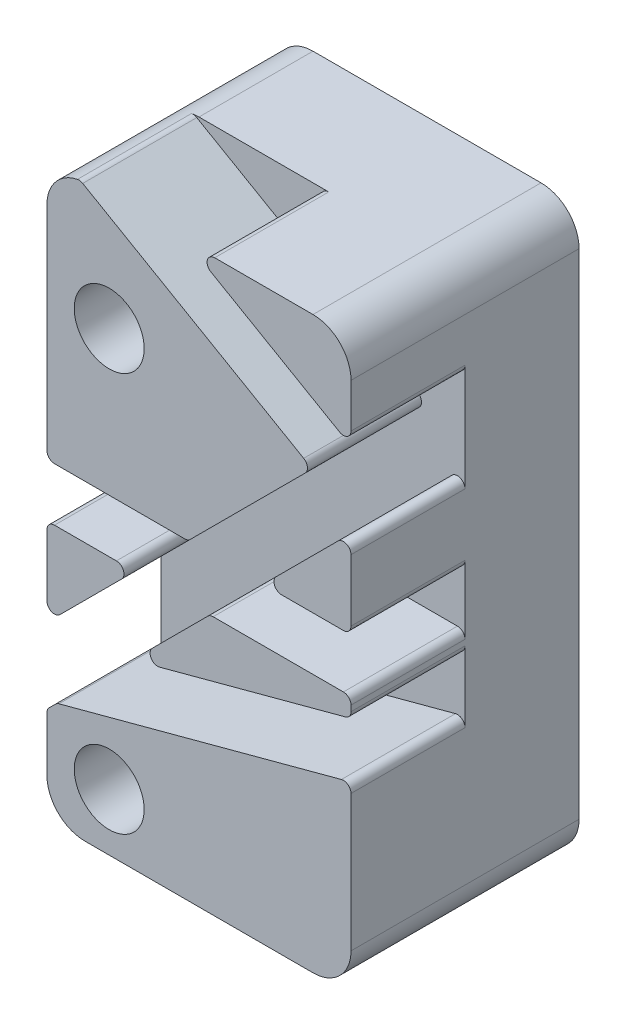
from build123d import *

# Parameters (mm, degrees)
SKETCH1_W           = 50.8
SKETCH1_H           = 95.25
BOSS_EXTRUDE1_DEPTH = 38.1
SKETCH2_W           = 74.255386752
SKETCH2_H           = 8.89
F_0_DEG_SLOT_DEPTH  = 19.05
SKETCH3_W           = 5.0292
SKETCH3_H           = 76.2
BOSS_EXTRUDE2_DEPTH = 6.35
SKETCH4_R           = 4.9022
CUT_EXTRUDE2_DEPTH  = 67.067470248
SKETCH5_R           = 5.842
CUT_EXTRUDE3_DEPTH  = 12.319
F_45DEG_SLOT_DEPTH  = 19.05
F_30_DEG_SLOT_DEPTH = 19.05
FILLET2_R           = 6.35
F_15_DEG_SLOT_DEPTH = 19.05
FILLET4_R           = 2.5146
FILLET3_R           = 1.27


with BuildPart() as part:
    # Sketch1 → Boss-Extrude1 (new body)
    with BuildSketch(Plane.XY):
        Rectangle(SKETCH1_W, SKETCH1_H)
    extrude(amount=BOSS_EXTRUDE1_DEPTH)

    # Sketch2 → 0 deg slot (cut)
    with BuildSketch(Plane.XY.offset(38.1)):
        Rectangle(SKETCH2_W, SKETCH2_H)
    extrude(amount=-F_0_DEG_SLOT_DEPTH, mode=Mode.SUBTRACT)

    # Sketch3 → Boss-Extrude2 (add)
    with BuildSketch(Plane(origin=(0, 0, 0), x_dir=(-1, 0, 0), z_dir=(0, 0, -1))):
        with Locations((-15, 0)):
            Rectangle(SKETCH3_W, SKETCH3_H)
    extrude(amount=BOSS_EXTRUDE2_DEPTH)

    # Sketch4 → Cut-Extrude2 (cut, through all)
    with BuildSketch(Plane(origin=(0, 0, 0), x_dir=(-1, 0, 0), z_dir=(0, 0, -1))):
        with Locations((15, 28.575)):
            Circle(SKETCH4_R)
        with Locations((15, -38.1)):
            Circle(SKETCH4_R)
    extrude(amount=-CUT_EXTRUDE2_DEPTH, mode=Mode.SUBTRACT)

    # Sketch5 → Cut-Extrude3 (cut)
    with BuildSketch(Plane.XY.offset(38.1)):
        with Locations((-15, -38.1)):
            Circle(SKETCH5_R)
        with Locations((-15, 28.575)):
            Circle(SKETCH5_R)
    extrude(amount=-CUT_EXTRUDE3_DEPTH, mode=Mode.SUBTRACT)

    # Sketch6 → 45deg slot (cut)
    with BuildSketch(Plane.XY.offset(38.1)):
        Polygon((42.977263594, 49.263442879), (-49.263442879, -42.977263594), (-42.977263594, -49.263442879), (49.263442879, 42.977263594), align=None)
    extrude(amount=-F_45DEG_SLOT_DEPTH, mode=Mode.SUBTRACT)

    # Sketch7 → 30 deg slot (cut)
    with BuildSketch(Plane.XY.offset(38.1)):
        Polygon((48.969673612, 7.869701865), (-53.414673612, 66.981332296), (-48.969673612, 74.680298135), (53.414673612, 15.568667704), align=None)
    extrude(amount=-F_30_DEG_SLOT_DEPTH, mode=Mode.SUBTRACT)

    # Fillet2
    fillet2_edges = [part.edges().sort_by_distance(p)[0] for p in [
        (-25.4, -47.625, 19.05),
        (25.4, -47.625, 19.05),
        (25.4, 47.625, 19.05),
        (-25.4, 47.625, 19.05),
    ]]
    fillet(fillet2_edges, radius=FILLET2_R)

    # Sketch10 → 15 deg slot (cut)
    with BuildSketch(Plane.XY.offset(38.1)):
        Polygon((55.707123796, -8.725123788), (-53.406222485, -37.961956807), (-55.707123796, -29.374876212), (53.406222485, -0.138043193), align=None)
    extrude(amount=-F_15_DEG_SLOT_DEPTH, mode=Mode.SUBTRACT)

    # Fillet4
    fillet4_edges = [part.edges().sort_by_distance(p)[0] for p in [
        (12.4854, 38.1, -3.175),
        (17.5146, 38.1, -3.175),
        (17.5146, -38.1, -3.175),
        (12.4854, -38.1, -3.175),
    ]]
    fillet(fillet4_edges, radius=FILLET4_R - 0.0001)  # a hair under: the kernel refuses the full size

    # Fillet3
    fillet3_edges = [part.edges().sort_by_distance(p)[0] for p in [
        (18.928057645, 25.21423693, 28.575),
        (-2.108522628, 47.625, 28.575),
        (25.4, 31.742947056, 28.575),
        (-19.809556788, 47.579409051, 28.575),
        (-23.721882631, -30.008061916, 28.575),
        (-11.149524062, -17.435703346, 28.575),
        (25.4, -7.64228789, 28.575),
        (25.4, -16.845893134, 28.575),
        (25.4, -4.445, 28.575),
        (-25.4, -4.445, 28.575),
        (25.4, 4.445, 28.575),
        (-25.4, 4.445, 28.575),
        (10.731179285, 4.445, 28.575),
        (-1.841179285, 4.445, 28.575),
        (-25.4, -19.113820715, 28.575),
        (-10.731179285, -4.445, 28.575),
        (25.4, 19.113820715, 28.575),
        (-25.4, -31.686179285, 28.575),
        (1.841179285, -4.445, 28.575),
    ]]
    fillet(fillet3_edges, radius=FILLET3_R)


solid = part.part
